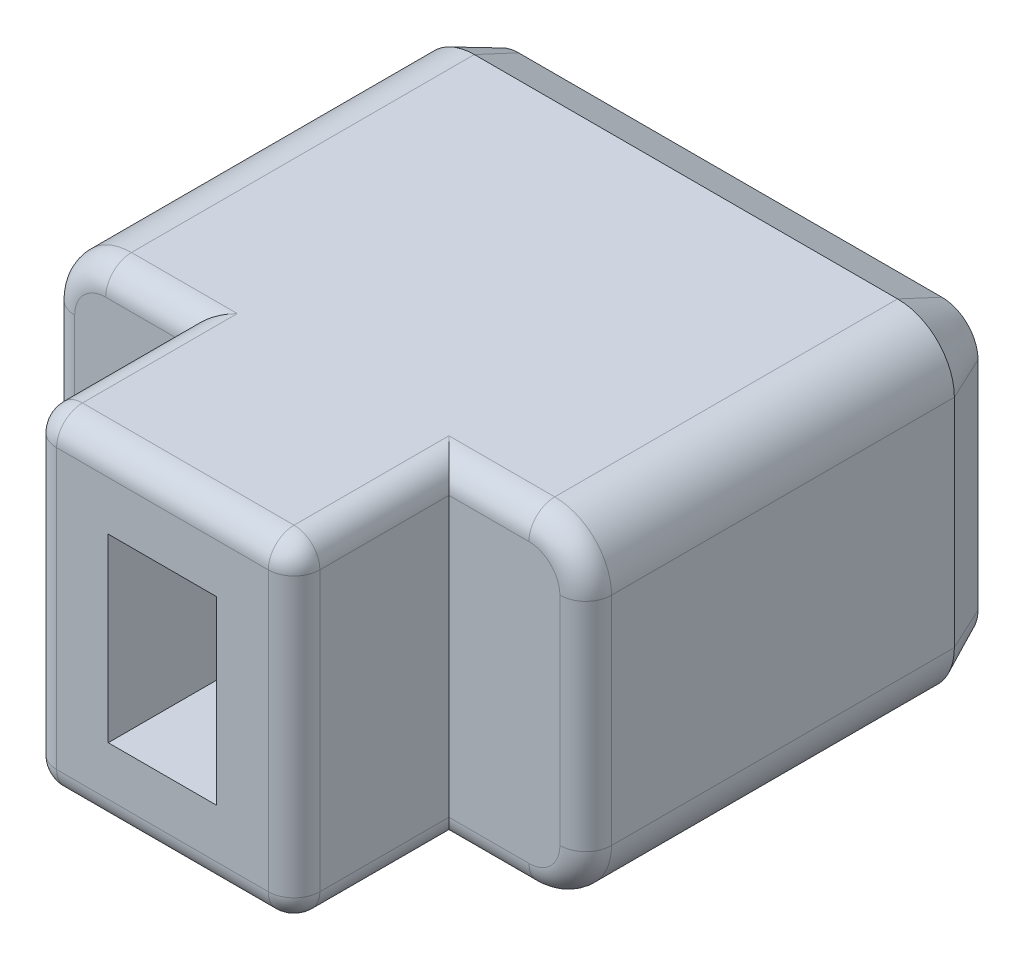
from build123d import *

# Parameters (mm, degrees)
BOSS_EXTRU_1_DEPTH      = 11
ESQUISSE3_W             = 2.1
ESQUISSE3_H             = 3.5
ENL_V_MAT_EXTRU_1_DEPTH = 3
ESQUISSE4_OUTSIDE_W     = 15.688
ESQUISSE4_OUTSIDE_H     = 11.688
ESQUISSE4_OUTSIDE_W_2   = 5.1
ESQUISSE4_OUTSIDE_H_2   = 6.4
ENL_V_MAT_EXTRU_2_DEPTH = 3
CONG_1_R                = 0.5
CHANFREIN1_SIZE         = 0.4
CHANFREIN1_SIZE2        = 0.857802768
ENL_V_MAT_EXTRU_3_DEPTH = 0.3
BOSS_EXTRU_2_DEPTH      = 0.3


with BuildPart() as part:
    # Esquisse2 → Boss.-Extru.1 (new body)
    with BuildSketch(Plane.XY):
        with BuildLine():
            Line((1.1, 0), (9.3, 0))
            ThreePointArc((9.3, 0), (10.077817459, 0.322182541), (10.4, 1.1))
            Line((10.4, 1.1), (10.4, 5.3))
            ThreePointArc((10.4, 5.3), (10.077817459, 6.077817459), (9.3, 6.4))
            Line((9.3, 6.4), (1.1, 6.4))
            ThreePointArc((1.1, 6.4), (0.322182541, 6.077817459), (0, 5.3))
            Line((0, 5.3), (0, 1.1))
            ThreePointArc((0, 1.1), (0.322182541, 0.322182541), (1.1, 0))
        make_face()
    extrude(amount=BOSS_EXTRU_1_DEPTH)

    # Esquisse3 → Enlèv. mat.-Extru.1 (cut)
    with BuildSketch(Plane.XY.offset(11)):
        with Locations((5.2, 3.2)):
            Rectangle(ESQUISSE3_W, ESQUISSE3_H)
    extrude(amount=-ENL_V_MAT_EXTRU_1_DEPTH, mode=Mode.SUBTRACT)

    # Esquisse4 outside → Enlèv. mat.-Extru.2 (cut)
    with BuildSketch(Plane.XY.offset(11)):
        with Locations((5.2, 3.2)):
            Rectangle(ESQUISSE4_OUTSIDE_W, ESQUISSE4_OUTSIDE_H)
        with Locations((5.2, 3.2)):
            Rectangle(ESQUISSE4_OUTSIDE_W_2, ESQUISSE4_OUTSIDE_H_2, mode=Mode.SUBTRACT)
    extrude(amount=-ENL_V_MAT_EXTRU_2_DEPTH, mode=Mode.SUBTRACT)

    # Congé1
    cong_1_edges = [part.edges().sort_by_distance(p)[0] for p in [
        (8.525, 0, 8),
        (10.077817459, 0.322182541, 8),
        (10.4, 3.2, 8),
        (10.077817459, 6.077817459, 8),
        (1.875, 6.4, 8),
        (0.322182541, 6.077817459, 8),
        (1.875, 0, 8),
        (0.322182541, 0.322182541, 8),
        (7.75, 6.4, 9.5),
        (2.65, 6.4, 9.5),
        (7.75, 0, 9.5),
        (2.65, 0, 9.5),
        (2.65, 3.2, 11),
        (5.2, 6.4, 11),
        (7.75, 3.2, 11),
        (5.2, 0, 11),
        (8.525, 6.4, 8),
        (0, 3.2, 8),
    ]]
    fillet(cong_1_edges, radius=CONG_1_R)

    # Chanfrein1
    chanfrein1_edges = [part.edges().sort_by_distance(p)[0] for p in [
        (5.2, 0, 0),
        (10.077817459, 0.322182541, 0),
        (0.322182541, 0.322182541, 0),
        (10.4, 3.2, 0),
        (0, 3.2, 0),
        (10.077817459, 6.077817459, 0),
        (0.322182541, 6.077817459, 0),
        (5.2, 6.4, 0),
    ]]
    chanfrein1_side = [part.faces().sort_by_distance(p)[0] for p in [
        (5.2, 3.2, 0),
    ]]
    chamfer(chanfrein1_edges, length=CHANFREIN1_SIZE, length2=CHANFREIN1_SIZE2, reference=chanfrein1_side[0])

    # Esquisse5 → Enlèv. mat.-Extru.3 (cut)
    with BuildSketch(Plane(origin=(0, 0, 0), x_dir=(-1, 0, 0), z_dir=(0, 0, -1))):
        Polygon((-5.947596154, 1.197435897), (-6.020512821, 1.197435897), (-6.020512821, 3.966666667), (-6.430769231, 3.966666667), (-6.430769231, 4.376923077), (-6.020512821, 4.376923077), (-6.020512821, 5.3), (-5.661538462, 5.3), (-5.661538462, 4.376923077), (-4.020512821, 4.376923077), align=None)
        Polygon((-5.661538462, 3.966666667), (-5.661538462, 2.387339744), (-4.704807692, 3.966666667), align=None, mode=Mode.SUBTRACT)
    extrude(amount=-ENL_V_MAT_EXTRU_3_DEPTH, mode=Mode.SUBTRACT)


with BuildPart() as body_2:
    # Esquisse5<2> → Boss.-Extru.2 (new body)
    with BuildSketch(Plane(origin=(0, 0, 0), x_dir=(-1, 0, 0), z_dir=(0, 0, -1))):
        Polygon((-5.947596154, 1.197435897), (-6.020512821, 1.197435897), (-6.020512821, 3.966666667), (-6.430769231, 3.966666667), (-6.430769231, 4.376923077), (-6.020512821, 4.376923077), (-6.020512821, 5.3), (-5.661538462, 5.3), (-5.661538462, 4.376923077), (-4.020512821, 4.376923077), align=None)
        Polygon((-5.661538462, 3.966666667), (-5.661538462, 2.387339744), (-4.704807692, 3.966666667), align=None, mode=Mode.SUBTRACT)
    extrude(amount=BOSS_EXTRU_2_DEPTH)


solid = Compound([part.part, body_2.part])
